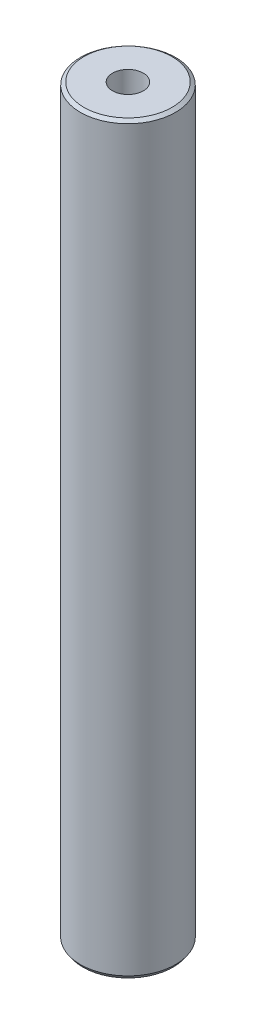
from build123d import *
from OCP.BRepFilletAPI import BRepFilletAPI_MakeChamfer

# Parameters (mm, degrees)
SKETCH1_R           = 35
BOSS_EXTRUDE1_DEPTH = 546.98257624
SKETCH2_R           = 11.322099774
CUT_EXTRUDE1_DEPTH  = 550.217569557
CHAMFER1_SIZE       = 1.837711682
CHAMFER1_SIZE2      = 2.62993612


with BuildPart() as part:
    # Sketch1 → Boss-Extrude1 (new body)
    with BuildSketch(Plane(origin=(0, 0, 0), x_dir=(1, 0, 0), z_dir=(0, 1, 0))):
        Circle(SKETCH1_R)
    extrude(amount=BOSS_EXTRUDE1_DEPTH)

    # Sketch2 → Cut-Extrude1 (cut, through all)
    with BuildSketch(Plane(origin=(0, 0, 0), x_dir=(1, 0, 0), z_dir=(0, 1, 0))):
        Circle(SKETCH2_R)
    extrude(amount=CUT_EXTRUDE1_DEPTH, mode=Mode.SUBTRACT)

    # Chamfer1: one chamfer whose edges measure the first distance from different faces: ONE call of the kernel's chamfer builder (chamfer() names one face for all edges)
    chamfer1_edges_1 = [part.edges().sort_by_distance(p)[0] for p in [
        (-35, 546.98257624, 0),
    ]]
    chamfer1_side_1 = [part.faces().sort_by_distance(p)[0] for p in [
        (-35, 273.49128812, 0),
    ]]
    chamfer1_edges_2 = [part.edges().sort_by_distance(p)[0] for p in [
        (-35, 0, 0),
    ]]
    chamfer1_side_2 = [part.faces().sort_by_distance(p)[0] for p in [
        (-34.010050506, 0, 0),
    ]]
    chamfer1 = BRepFilletAPI_MakeChamfer(part.part.solid().wrapped)
    for e in chamfer1_edges_1:
        chamfer1.Add(CHAMFER1_SIZE, CHAMFER1_SIZE2, e.wrapped, chamfer1_side_1[0].wrapped)  # the first distance lies on this face
    for e in chamfer1_edges_2:
        chamfer1.Add(CHAMFER1_SIZE, CHAMFER1_SIZE2, e.wrapped, chamfer1_side_2[0].wrapped)  # the first distance lies on this face
    add(Compound.cast(chamfer1.Shape()), mode=Mode.REPLACE)


solid = part.part
